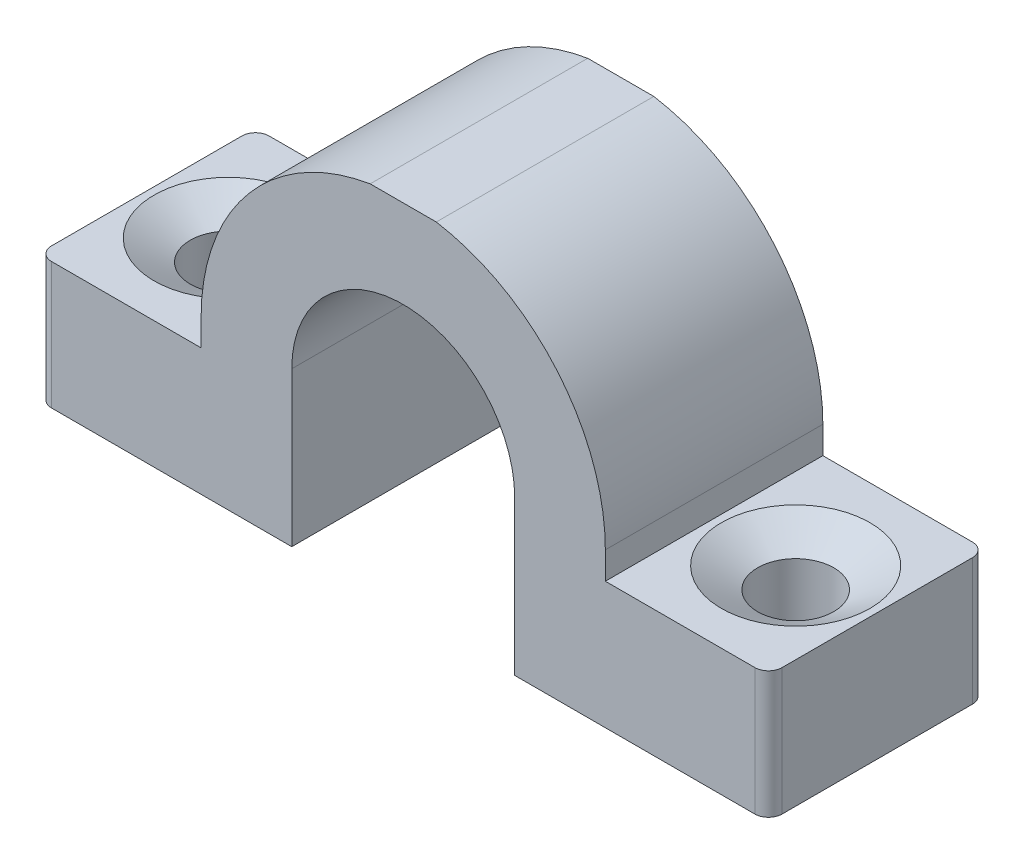
from build123d import *
from OCP.BRepFilletAPI import BRepFilletAPI_MakeChamfer

# Parameters (mm, degrees)
BOSS_EXTRUDE1_DEPTH = 12
SKETCH4_R           = 2.1
CUT_EXTRUDE1_DEPTH  = 27.646669586
CHAMFER1_SIZE       = 2
CHAMFER1_SIZE2      = 1.154700538
SKETCH5_W           = 17.126081539
SKETCH5_H           = 14.483771816
CUT_EXTRUDE2_DEPTH  = 31.50036885
FILLET2_R           = 0.75


with BuildPart() as part:
    # Sketch1 → Boss-Extrude1 (new body)
    with BuildSketch(Plane.XY):
        with BuildLine():
            Line((-11.15, 0), (-11.15, -1.5))
            Line((-11.15, -1.5), (-20.15, -1.5))
            Line((-20.15, -1.5), (-20.15, -8.5))
            Line((-20.15, -8.5), (-6.15, -8.5))
            Line((-6.15, -8.5), (-6.15, 0))
            ThreePointArc((-6.15, 0), (0, 6.15), (6.15, 0))
            Line((6.15, 0), (6.15, -8.5))
            Line((6.15, -8.5), (20.15, -8.5))
            Line((20.15, -8.5), (20.15, -1.5))
            Line((20.15, -1.5), (11.15, -1.5))
            Line((11.15, -1.5), (11.15, 0))
            ThreePointArc((11.15, 0), (0, 11.15), (-11.15, 0))
        make_face()
    extrude(amount=BOSS_EXTRUDE1_DEPTH)

    # Sketch4 → Cut-Extrude1 (cut, through all)
    with BuildSketch(Plane(origin=(0, -1.5, 0), x_dir=(1, 0, 0), z_dir=(0, 1, 0))):
        with Locations((-15.65, -6)):
            Circle(SKETCH4_R)
        with Locations((15.65, -6)):
            Circle(SKETCH4_R)
    extrude(amount=-CUT_EXTRUDE1_DEPTH, mode=Mode.SUBTRACT)

    # Chamfer1: one chamfer whose edges measure the first distance from different faces: ONE call of the kernel's chamfer builder (chamfer() names one face for all edges)
    chamfer1_edges_1 = [part.edges().sort_by_distance(p)[0] for p in [
        (13.55, -1.5, 6),
    ]]
    chamfer1_side_1 = [part.faces().sort_by_distance(p)[0] for p in [
        (20, -1.5, 6),
    ]]
    chamfer1_edges_2 = [part.edges().sort_by_distance(p)[0] for p in [
        (-17.75, -1.5, 6),
    ]]
    chamfer1_side_2 = [part.faces().sort_by_distance(p)[0] for p in [
        (-11.3, -1.5, 6),
    ]]
    chamfer1 = BRepFilletAPI_MakeChamfer(part.part.solid().wrapped)
    for e in chamfer1_edges_1:
        chamfer1.Add(CHAMFER1_SIZE, CHAMFER1_SIZE2, e.wrapped, chamfer1_side_1[0].wrapped)  # the first distance lies on this face
    for e in chamfer1_edges_2:
        chamfer1.Add(CHAMFER1_SIZE, CHAMFER1_SIZE2, e.wrapped, chamfer1_side_2[0].wrapped)  # the first distance lies on this face
    add(Compound.cast(chamfer1.Shape()), mode=Mode.REPLACE)

    # Sketch5 → Cut-Extrude2 (cut, through all)
    with BuildSketch(Plane(origin=(0, 11, 0), x_dir=(1, 0, 0), z_dir=(0, 1, 0))):
        with Locations((0.195726647, -5.794276843)):
            Rectangle(SKETCH5_W, SKETCH5_H)
    extrude(amount=CUT_EXTRUDE2_DEPTH, mode=Mode.SUBTRACT)

    # Fillet2
    fillet2_edges = [part.edges().sort_by_distance(p)[0] for p in [
        (20.15, -5, 0),
        (20.15, -5, 12),
        (-20.15, -5, 0),
        (-20.15, -5, 12),
    ]]
    fillet(fillet2_edges, radius=FILLET2_R)


solid = part.part
